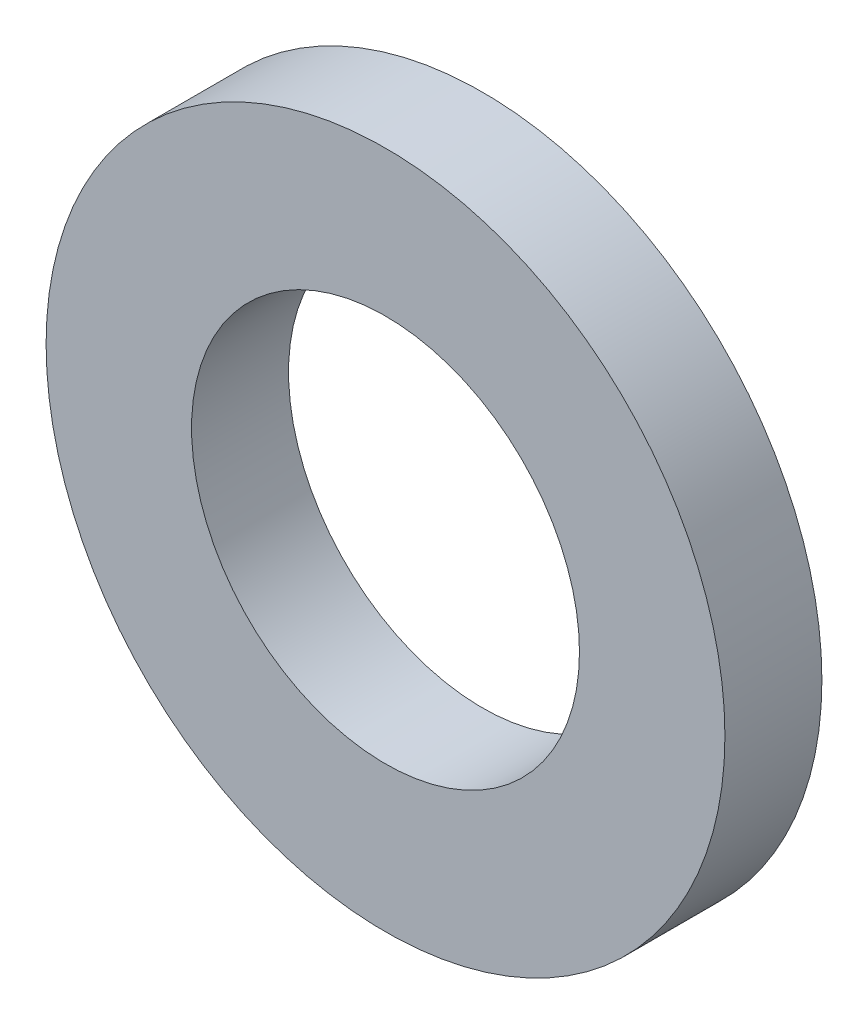
from build123d import *

# Parameters (mm, degrees)
BOSS_EXTRUDE1_DEPTH      = 1
BOSS_EXTRUDE1_DEPTH_BACK = 1
SKETCH2_R                = 7
SKETCH2_R_2              = 4


with BuildPart() as part:
    # Sketch2 → Boss-Extrude1 (new, two sides: drawn at the far end of the back side and taken through both)
    with BuildSketch(Plane.XY.offset(-BOSS_EXTRUDE1_DEPTH_BACK)):
        Circle(SKETCH2_R)
        Circle(SKETCH2_R_2, mode=Mode.SUBTRACT)
    extrude(amount=BOSS_EXTRUDE1_DEPTH + BOSS_EXTRUDE1_DEPTH_BACK)


solid = part.part
